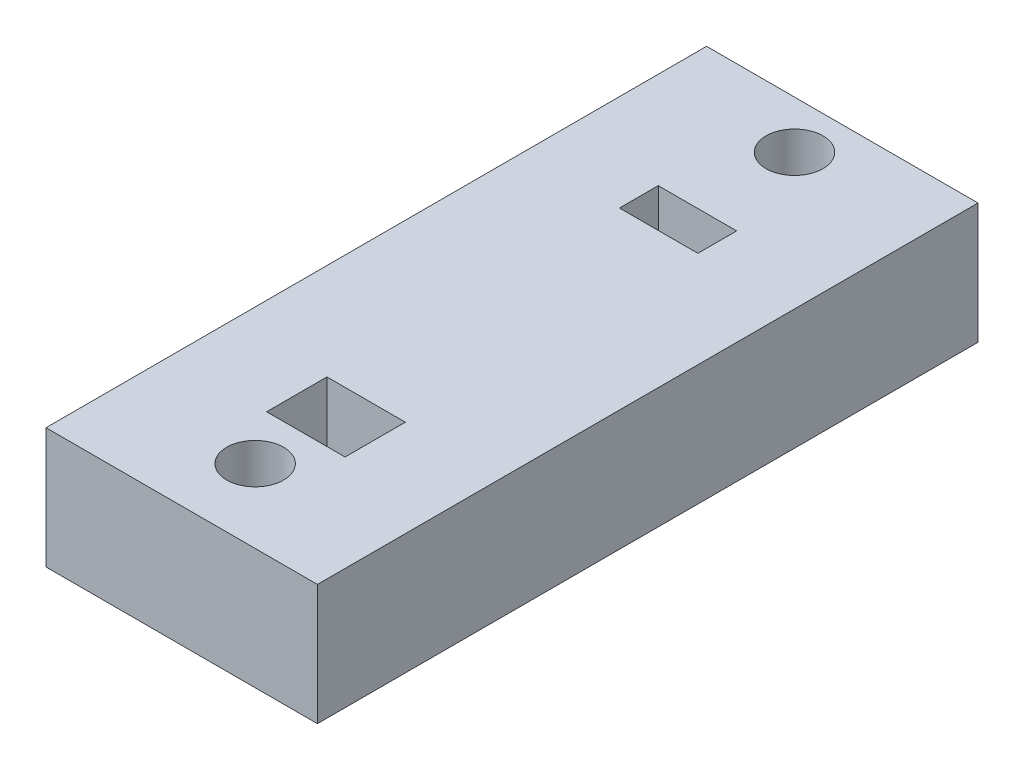
from build123d import *

# Parameters (mm, degrees)
SKETCH1_W           = 9
SKETCH1_H           = 21.904607532
SKETCH1_R           = 0.943919462
SKETCH1_W_2         = 2.6
SKETCH1_H_2         = 1.285874232
SKETCH1_H_3         = 2
BOSS_EXTRUDE1_DEPTH = 4


with BuildPart() as part:
    # Sketch1 → Boss-Extrude1 (new body)
    with BuildSketch(Plane(origin=(0, 0, 0), x_dir=(1, 0, 0), z_dir=(0, 1, 0))):
        with Locations((4.5, 10.952303766)):
            Rectangle(SKETCH1_W, SKETCH1_H)
        with Locations((4.5, 20.319985407)):
            Circle(SKETCH1_R, mode=Mode.SUBTRACT)
        with Locations((4.5, 2.435628834)):
            Circle(SKETCH1_R, mode=Mode.SUBTRACT)
        with Locations((4.5, 16.459116146)):
            Rectangle(SKETCH1_W_2, SKETCH1_H_2, mode=Mode.SUBTRACT)
        with Locations((4.5, 5.11617903)):
            Rectangle(SKETCH1_W_2, SKETCH1_H_3, mode=Mode.SUBTRACT)
    extrude(amount=BOSS_EXTRUDE1_DEPTH)


solid = part.part
